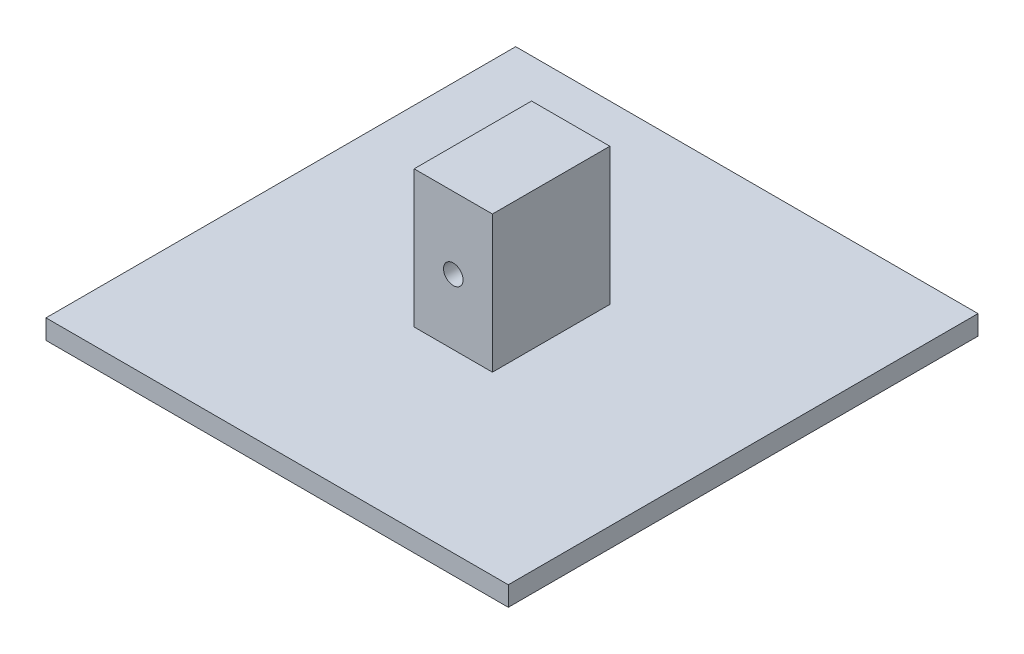
from build123d import *

# Parameters (mm, degrees)
BOSS_EXTRUDE1_DEPTH         = 12.7
BOSS_EXTRUDE1_DEPTH_BACK    = 12.7
F_1_4_0_25_DIAMETER_HOLE1_D = 6.35
BOSS_EXTRUDE2_DEPTH         = 75
BOSS_EXTRUDE2_DEPTH_BACK    = 75
SKETCH6_W                   = 152.4
SKETCH6_H                   = 6.35


with BuildPart() as part:
    # Sketch-Profile → Boss-Extrude1 (new, two sides: drawn at the far end of the back side and taken through both)
    with BuildSketch(Plane(origin=(0, 0, 0), x_dir=(0, 0, -1), z_dir=(1, 0, 0)).offset(-BOSS_EXTRUDE1_DEPTH_BACK)):
        Polygon((-76.2, 6.35), (-76.2, 0), (76.2, 0), (76.2, 6.35), (19.05, 6.35), (19.05, 50.8), (-19.05, 50.8), (-19.05, 6.35), align=None)
    extrude(amount=BOSS_EXTRUDE1_DEPTH + BOSS_EXTRUDE1_DEPTH_BACK)

    # 1/4 (0.25) Diameter Hole1 (through all)
    with Locations(Plane.XY.offset(19.05)):
        with Locations((0, 27.5181)):
            Hole(F_1_4_0_25_DIAMETER_HOLE1_D / 2)

    # Sketch6 → Boss-Extrude2 (add, two sides: drawn at the far end of the back side and taken through both)
    with BuildSketch(Plane(origin=(0, 0, 0), x_dir=(0, 0, -1), z_dir=(1, 0, 0)).offset(-BOSS_EXTRUDE2_DEPTH_BACK)):
        with Locations((0, 3.175)):
            Rectangle(SKETCH6_W, SKETCH6_H)
    extrude(amount=BOSS_EXTRUDE2_DEPTH + BOSS_EXTRUDE2_DEPTH_BACK)


solid = part.part
